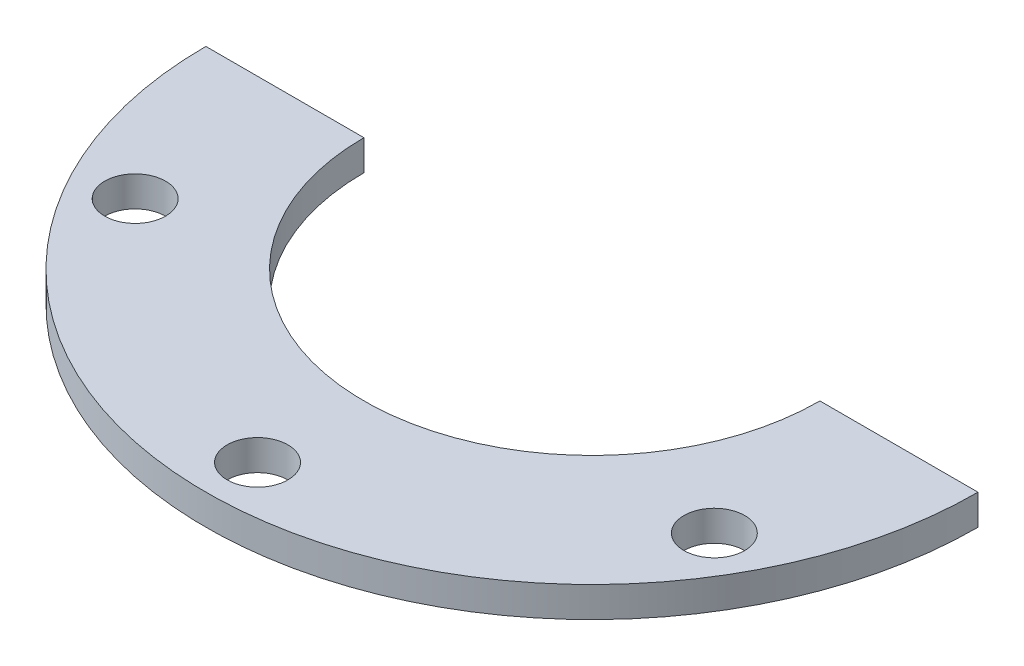
from build123d import *

# Parameters (mm, degrees)
SKETCH1_R               = 12.7
BOSS_EXTRUDE1_DEPTH     = 1
CUT_EXTRUDE1_DEPTH      = 18.98832955
CUT_EXTRUDE1_DEPTH_BACK = 18.98832955
SKETCH19_R              = 1
CUT_EXTRUDE2_DEPTH      = 18.98832955
CUT_EXTRUDE2_DEPTH_BACK = 18.98832955
SKETCH20_R              = 7.5
SKETCH21_W              = 65.874202484
SKETCH21_H              = 51.979273979
CUT_EXTRUDE3_DEPTH      = 18.98832955


with BuildPart() as part:
    # Sketch1 → Boss-Extrude1 (new body)
    with BuildSketch(Plane(origin=(0, 0, 0), x_dir=(1, 0, 0), z_dir=(0, 1, 0))):
        Circle(SKETCH1_R)
    extrude(amount=BOSS_EXTRUDE1_DEPTH)

    # Sketch19 → Cut-Extrude1 (cut, two sides: drawn at the far end of the back side and taken through both)
    with BuildSketch(Plane(origin=(0, 1, 0), x_dir=(1, 0, 0), z_dir=(0, 1, 0)).offset(-CUT_EXTRUDE1_DEPTH_BACK)):
        with Locations((0, 11)):
            Circle(SKETCH19_R)
        with Locations((9.526279442, 5.5)):
            Circle(SKETCH19_R)
        with Locations((9.526279442, -5.5)):
            Circle(SKETCH19_R)
        with Locations((0, -11)):
            Circle(SKETCH19_R)
        with Locations((-9.526279442, -5.5)):
            Circle(SKETCH19_R)
        with Locations((-9.526279442, 5.5)):
            Circle(SKETCH19_R)
    extrude(amount=CUT_EXTRUDE1_DEPTH + CUT_EXTRUDE1_DEPTH_BACK, mode=Mode.SUBTRACT)

    # Sketch20 → Cut-Extrude2 (cut, two sides: drawn at the far end of the back side and taken through both)
    with BuildSketch(Plane(origin=(0, 1, 0), x_dir=(1, 0, 0), z_dir=(0, 1, 0)).offset(-CUT_EXTRUDE2_DEPTH_BACK)):
        Circle(SKETCH20_R)
    extrude(amount=CUT_EXTRUDE2_DEPTH + CUT_EXTRUDE2_DEPTH_BACK, mode=Mode.SUBTRACT)

    # Sketch21 → Cut-Extrude3 (cut, through all)
    with BuildSketch(Plane.XY):
        with Locations((-3.816154381, 6.321647006)):
            Rectangle(SKETCH21_W, SKETCH21_H)
    extrude(amount=-CUT_EXTRUDE3_DEPTH, mode=Mode.SUBTRACT)


solid = part.part
